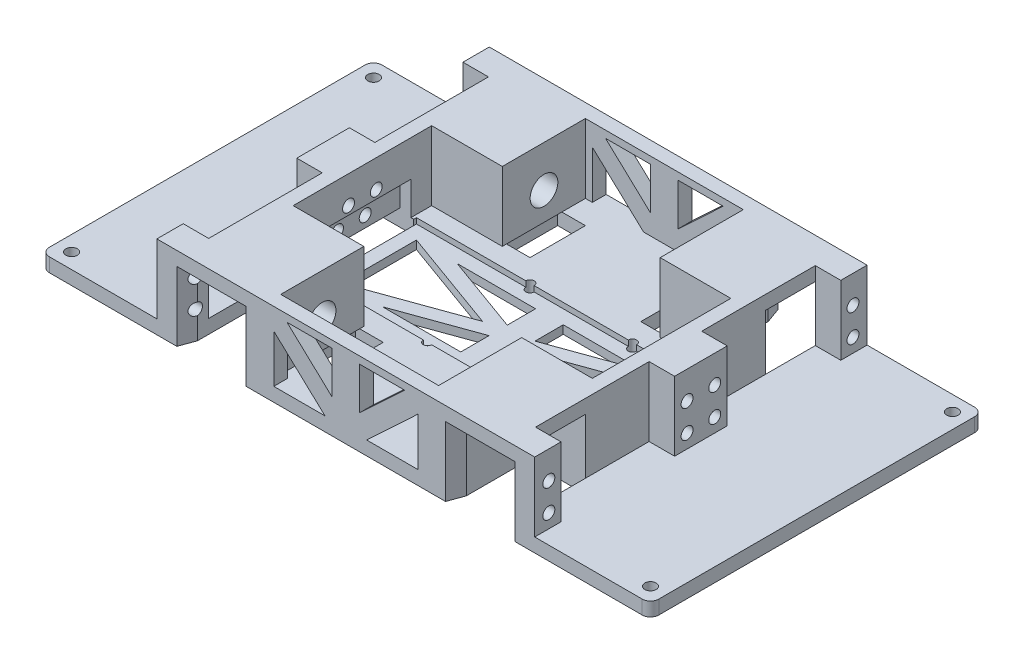
from build123d import *
from OCP.BRepFilletAPI import BRepFilletAPI_MakeChamfer

# Parameters (mm, degrees)
EXTRUDE_1_DEPTH          = 5
SKETCH_9_W               = 106
SKETCH_9_H               = 37
CUT_EXTRUDE_5_DEPTH      = 2
SKETCH_2_W               = 9.2
SKETCH_2_H               = 9.5
EXTRUDE_2_DEPTH          = 25
CUT_EXTRUDE_1_DEPTH      = 129.840987267
CUT_EXTRUDE_1_DEPTH_BACK = 129.840987267
SKETCH_4_R               = 2.15
SKETCH_6_R               = 5
CUT_EXTRUDE_2_DEPTH      = 45
CUT_EXTRUDE_3_REACH      = 192.408
SKETCH_7_R               = 2.15
CUT_EXTRUDE_4_REACH      = 192.408
SKETCH_8_R               = 2.15
CUT_EXTRUDE_6_DEPTH      = 12
CUT_EXTRUDE_6_DEPTH_BACK = 128.769323392
SKETCH_10_W              = 5
SKETCH_10_H              = 35
SKETCH_11_R              = 2.05
SKETCH_11_R_2            = 1.5
SKETCH_11_W              = 10
SKETCH_11_H              = 20
CUT_EXTRUDE_7_DEPTH      = 128.769323392
SKETCH_12_W              = 30.5
SKETCH_12_H              = 35
EXTRUDE_3_DEPTH          = 5
CUT_EXTRUDE_8_DEPTH      = 129.840987267
CUT_EXTRUDE_8_DEPTH_BACK = 129.840987267
CHAMFER_1_SIZE           = 1.5
CHAMFER_1_SIZE2          = 1.787630389
FILLET_1_R               = 3
CHAMFER_2_SIZE           = 6
CHAMFER_3_SIZE           = 5.494954839
CHAMFER_3_SIZE_2         = 2


with BuildPart() as part:
    # 草圖1 → 填料-伸長1 (new body)
    with BuildSketch(Plane(origin=(0, 0, 0), x_dir=(1, 0, 0), z_dir=(0, 1, 0))):
        Polygon((-110, -60), (-59, -60), (-59, -32.5), (-38, -32.5), (-38, -60), (38, -60), (38, -32.5), (59, -32.5), (59, -60), (110, -60), (110, 60), (59, 60), (59, 32.5), (38, 32.5), (38, 60), (-38, 60), (-38, 32.5), (-59, 32.5), (-59, 60), (-110, 60), align=None)
    extrude(amount=EXTRUDE_1_DEPTH)

    # 草圖9 → 除料-伸長5 (cut)
    with BuildSketch(Plane(origin=(0, 5, 0), x_dir=(1, 0, 0), z_dir=(0, 1, 0))):
        Rectangle(SKETCH_9_W, SKETCH_9_H)
    extrude(amount=-CUT_EXTRUDE_5_DEPTH, mode=Mode.SUBTRACT)

    # 草圖2 → 填料-伸長2 (add)
    # profile 1 of 5: a face of its own
    with BuildSketch(Plane(origin=(0, 5, 0), x_dir=(1, 0, 0), z_dir=(0, 1, 0))):
        Polygon((-59, 32.5), (-59, 9.5), (-68.2, 9.5), (-68.2, -9.5), (-59, -9.5), (-59, -32.5), (-38, -32.5), (-38, -60), (38, -60), (38, -32.5), (59, -32.5), (59, -9.5), (68.2, -9.5), (68.2, 9.5), (59, 9.5), (59, 32.5), (38, 32.5), (38, 60), (-38, 60), (-38, 32.5), align=None)
        Polygon((-28.5, 55), (28.5, 55), (28.5, 25), (54, 25), (54, -25), (28.5, -25), (28.5, -55), (-28.5, -55), (-28.5, -25), (-54, -25), (-54, 25), (-28.5, 25), align=None, mode=Mode.SUBTRACT)
    # profile 2 of 5: a face of its own
    with BuildSketch(Plane(origin=(0, 5, 0), x_dir=(1, 0, 0), z_dir=(0, 1, 0))):
        with Locations((-63.6, 55.25)):
            Rectangle(SKETCH_2_W, SKETCH_2_H)
    # profile 3 of 5: a face of its own
    with BuildSketch(Plane(origin=(0, 5, 0), x_dir=(1, 0, 0), z_dir=(0, 1, 0))):
        with Locations((63.6, 55.25)):
            Rectangle(SKETCH_2_W, SKETCH_2_H)
    # profile 4 of 5: a face of its own
    with BuildSketch(Plane(origin=(0, 5, 0), x_dir=(1, 0, 0), z_dir=(0, 1, 0))):
        with Locations((63.6, -55.25)):
            Rectangle(SKETCH_2_W, SKETCH_2_H)
    # profile 5 of 5: a face of its own
    with BuildSketch(Plane(origin=(0, 5, 0), x_dir=(1, 0, 0), z_dir=(0, 1, 0))):
        with Locations((-63.6, -55.25)):
            Rectangle(SKETCH_2_W, SKETCH_2_H)
    extrude(amount=EXTRUDE_2_DEPTH)

    # 草圖4 → 除料-伸長1 (cut, two sides: drawn at the far end of the back side and taken through both)
    with BuildSketch(Plane(origin=(0, 0, 0), x_dir=(0, 0, -1), z_dir=(1, 0, 0)).offset(-CUT_EXTRUDE_1_DEPTH_BACK)):
        with Locations(Location((-5, 20, 0), (0, 0, 180))):
            Circle(SKETCH_4_R)
        with Locations(Location((-5, 10, 0), (0, 0, 180))):
            Circle(SKETCH_4_R)
        with Locations(Location((5, 10, 0), (0, 0, 180))):
            Circle(SKETCH_4_R)
        with Locations(Location((5, 20, 0), (0, 0, 180))):
            Circle(SKETCH_4_R)
    extrude(amount=CUT_EXTRUDE_1_DEPTH + CUT_EXTRUDE_1_DEPTH_BACK, mode=Mode.SUBTRACT)

    # 草圖6 → 除料-伸長2 (cut, symmetric)
    with BuildSketch(Plane(origin=(0, 0, 0), x_dir=(0, 0, -1), z_dir=(1, 0, 0))):
        with Locations((-40.049999551, 15.006658077)):
            Circle(SKETCH_6_R)
        with Locations((40.049999551, 15.006658077)):
            Circle(SKETCH_6_R)
    extrude(amount=CUT_EXTRUDE_2_DEPTH, both=True, mode=Mode.SUBTRACT)

    # 草圖7 → 除料-伸長3 (cut, up to next)
    with BuildSketch(Plane.ZY.offset(68.2), mode=Mode.PRIVATE) as cut_extrude_3_sk1:
        with Locations((-54.9, 20)):
            Circle(SKETCH_7_R)
    cut_extrude_3_tool1 = extrude(cut_extrude_3_sk1.sketch, amount=-CUT_EXTRUDE_3_REACH, mode=Mode.PRIVATE) & part.part
    # 草圖7 → 除料-伸長3 (cut, up to next)
    with BuildSketch(Plane.ZY.offset(68.2), mode=Mode.PRIVATE) as cut_extrude_3_sk2:
        with Locations((-54.9, 10.006658077)):
            Circle(SKETCH_7_R)
    cut_extrude_3_tool2 = extrude(cut_extrude_3_sk2.sketch, amount=-CUT_EXTRUDE_3_REACH, mode=Mode.PRIVATE) & part.part
    # 草圖7 → 除料-伸長3 (cut, up to next)
    with BuildSketch(Plane.ZY.offset(68.2), mode=Mode.PRIVATE) as cut_extrude_3_sk3:
        with Locations((54.9, 10.006658077)):
            Circle(SKETCH_7_R)
    cut_extrude_3_tool3 = extrude(cut_extrude_3_sk3.sketch, amount=-CUT_EXTRUDE_3_REACH, mode=Mode.PRIVATE) & part.part
    # 草圖7 → 除料-伸長3 (cut, up to next)
    with BuildSketch(Plane.ZY.offset(68.2), mode=Mode.PRIVATE) as cut_extrude_3_sk4:
        with Locations((54.9, 20)):
            Circle(SKETCH_7_R)
    cut_extrude_3_tool4 = extrude(cut_extrude_3_sk4.sketch, amount=-CUT_EXTRUDE_3_REACH, mode=Mode.PRIVATE) & part.part
    add(cut_extrude_3_tool1.solids().sort_by_distance((-68.2, 20, -54.9))[0], mode=Mode.SUBTRACT)
    add(cut_extrude_3_tool2.solids().sort_by_distance((-68.2, 10.006658, -54.9))[0], mode=Mode.SUBTRACT)
    add(cut_extrude_3_tool3.solids().sort_by_distance((-68.2, 10.006658, 54.9))[0], mode=Mode.SUBTRACT)
    add(cut_extrude_3_tool4.solids().sort_by_distance((-68.2, 20, 54.9))[0], mode=Mode.SUBTRACT)

    # 草圖8 → 除料-伸長4 (cut, up to next)
    with BuildSketch(Plane(origin=(68.2, 0, 0), x_dir=(0, 0, -1), z_dir=(1, 0, 0)), mode=Mode.PRIVATE) as cut_extrude_4_sk1:
        with Locations(Location((-54.9, 10.006658077, 0), (0, 0, 180))):
            Circle(SKETCH_8_R)
    cut_extrude_4_tool1 = extrude(cut_extrude_4_sk1.sketch, amount=-CUT_EXTRUDE_4_REACH, mode=Mode.PRIVATE) & part.part
    # 草圖8 → 除料-伸長4 (cut, up to next)
    with BuildSketch(Plane(origin=(68.2, 0, 0), x_dir=(0, 0, -1), z_dir=(1, 0, 0)), mode=Mode.PRIVATE) as cut_extrude_4_sk2:
        with Locations(Location((-54.9, 20, 0), (0, 0, 180))):
            Circle(SKETCH_8_R)
    cut_extrude_4_tool2 = extrude(cut_extrude_4_sk2.sketch, amount=-CUT_EXTRUDE_4_REACH, mode=Mode.PRIVATE) & part.part
    # 草圖8 → 除料-伸長4 (cut, up to next)
    with BuildSketch(Plane(origin=(68.2, 0, 0), x_dir=(0, 0, -1), z_dir=(1, 0, 0)), mode=Mode.PRIVATE) as cut_extrude_4_sk3:
        with Locations(Location((54.9, 10.006658077, 0), (0, 0, 180))):
            Circle(SKETCH_8_R)
    cut_extrude_4_tool3 = extrude(cut_extrude_4_sk3.sketch, amount=-CUT_EXTRUDE_4_REACH, mode=Mode.PRIVATE) & part.part
    # 草圖8 → 除料-伸長4 (cut, up to next)
    with BuildSketch(Plane(origin=(68.2, 0, 0), x_dir=(0, 0, -1), z_dir=(1, 0, 0)), mode=Mode.PRIVATE) as cut_extrude_4_sk4:
        with Locations(Location((54.9, 20, 0), (0, 0, 180))):
            Circle(SKETCH_8_R)
    cut_extrude_4_tool4 = extrude(cut_extrude_4_sk4.sketch, amount=-CUT_EXTRUDE_4_REACH, mode=Mode.PRIVATE) & part.part
    add(cut_extrude_4_tool1.solids().sort_by_distance((68.2, 10.006658, 54.9))[0], mode=Mode.SUBTRACT)
    add(cut_extrude_4_tool2.solids().sort_by_distance((68.2, 20, 54.9))[0], mode=Mode.SUBTRACT)
    add(cut_extrude_4_tool3.solids().sort_by_distance((68.2, 10.006658, -54.9))[0], mode=Mode.SUBTRACT)
    add(cut_extrude_4_tool4.solids().sort_by_distance((68.2, 20, -54.9))[0], mode=Mode.SUBTRACT)

    # 草圖10 → 除料-伸長6 (cut, two sides: drawn at the far end of the back side and taken through both)
    with BuildSketch(Plane(origin=(0, 5, 0), x_dir=(1, 0, 0), z_dir=(0, 1, 0)).offset(-CUT_EXTRUDE_6_DEPTH_BACK)):
        with Locations((-55.5, 0)):
            Rectangle(SKETCH_10_W, SKETCH_10_H)
        with Locations((55.5, 0)):
            Rectangle(SKETCH_10_W, SKETCH_10_H)
    extrude(amount=CUT_EXTRUDE_6_DEPTH + CUT_EXTRUDE_6_DEPTH_BACK, mode=Mode.SUBTRACT)

    # 草圖11 → 除料-伸長7 (cut, through all)
    with BuildSketch(Plane(origin=(0, 5, 0), x_dir=(1, 0, 0), z_dir=(0, 1, 0))):
        with Locations(Location((104.5, 54.5, 0), (0, 0, 270))):
            Circle(SKETCH_11_R)
        with Locations(Location((-104.5, 54.5, 0), (0, 0, 90))):
            Circle(SKETCH_11_R)
        with Locations(Location((-104.5, -54.5, 0), (0, 0, 270))):
            Circle(SKETCH_11_R)
        with Locations(Location((104.5, -54.5, 0), (0, 0, 90))):
            Circle(SKETCH_11_R)
        with Locations(Location((-12, 18.5, 0), (0, 0, 270))):
            Circle(SKETCH_11_R_2)
        with Locations(Location((25, 18.5, 0), (0, 0, 270))):
            Circle(SKETCH_11_R_2)
        with Locations((25, -18.5)):
            Circle(SKETCH_11_R_2)
        with Locations((-12, -18.5)):
            Circle(SKETCH_11_R_2)
        Polygon((-48, 13.5), (-48, -13.5), (-10.631434842, 0), align=None)
        Polygon((-33.284314696, 13.5), (-5, 13.5), (-5, 3.281832758), align=None)
        Polygon((48, -13.5), (10.631434842, 0), (48, 13.5), align=None)
        Polygon((5, 13.5), (5, 3.281832758), (33.284314696, 13.5), align=None)
        Polygon((33.284314696, -13.5), (5, -13.5), (5, -3.281832758), align=None)
        Polygon((-5, -13.5), (-5, -3.281832758), (-33.284314696, -13.5), align=None)
        with Locations((25, 36.5)):
            Rectangle(SKETCH_11_W, SKETCH_11_H)
        with Locations((-25, 36.5)):
            Rectangle(SKETCH_11_W, SKETCH_11_H)
        with Locations((25, -36.5)):
            Rectangle(SKETCH_11_W, SKETCH_11_H)
        with Locations((-25, -36.5)):
            Rectangle(SKETCH_11_W, SKETCH_11_H)
    extrude(amount=-CUT_EXTRUDE_7_DEPTH, mode=Mode.SUBTRACT)

    # 草圖12 → 填料-伸長3 (add)
    with BuildSketch(Plane(origin=(0, 30, 0), x_dir=(1, 0, 0), z_dir=(0, 1, 0))):
        with Locations((-43.75, 42.5)):
            Rectangle(SKETCH_12_W, SKETCH_12_H)
        with Locations((43.75, 42.5)):
            Rectangle(SKETCH_12_W, SKETCH_12_H)
        with Locations((43.75, -42.5)):
            Rectangle(SKETCH_12_W, SKETCH_12_H)
        with Locations((-43.75, -42.5)):
            Rectangle(SKETCH_12_W, SKETCH_12_H)
    extrude(amount=-EXTRUDE_3_DEPTH)

    # 草圖13 → 除料-伸長8 (cut, two sides: drawn at the far end of the back side and taken through both)
    with BuildSketch(Plane.XY.offset(-CUT_EXTRUDE_8_DEPTH_BACK)):
        Polygon((-26, 22.289142729), (-26, 5), (-7.5, 5), align=None)
        Polygon((-21.244781105, 27.426165415), (-5, 12.24463357), (-5, 27.426165415), align=None)
        Polygon((26, 5), (7.5, 5), (26, 22.289142729), align=None)
        Polygon((5, 12.24463357), (5, 27.426165415), (21.244781105, 27.426165415), align=None)
    extrude(amount=CUT_EXTRUDE_8_DEPTH + CUT_EXTRUDE_8_DEPTH_BACK, mode=Mode.SUBTRACT)

    # 導角1: one chamfer whose edges measure the first distance from different faces: ONE call of the kernel's chamfer builder (chamfer() names one face for all edges)
    chamfer_1_edges_1 = [part.edges().sort_by_distance(p)[0] for p in [
        (-38, 15.006658077, 45.049999551),
    ]]
    chamfer_1_side_1 = [part.faces().sort_by_distance(p)[0] for p in [
        (-33.25, 15.006658077, 45.049999551),
    ]]
    chamfer_1_edges_2 = [part.edges().sort_by_distance(p)[0] for p in [
        (38, 15.006658077, 45.049999551),
    ]]
    chamfer_1_side_2 = [part.faces().sort_by_distance(p)[0] for p in [
        (33.25, 15.006658077, 45.049999551),
    ]]
    chamfer_1_edges_3 = [part.edges().sort_by_distance(p)[0] for p in [
        (38, 15.006658077, -35.049999551),
    ]]
    chamfer_1_side_3 = [part.faces().sort_by_distance(p)[0] for p in [
        (33.25, 15.006658077, -35.049999551),
    ]]
    chamfer_1_edges_4 = [part.edges().sort_by_distance(p)[0] for p in [
        (-38, 15.006658077, -35.049999551),
    ]]
    chamfer_1_side_4 = [part.faces().sort_by_distance(p)[0] for p in [
        (-33.25, 15.006658077, -35.049999551),
    ]]
    chamfer_1 = BRepFilletAPI_MakeChamfer(part.part.solid().wrapped)
    for e in chamfer_1_edges_1:
        chamfer_1.Add(CHAMFER_1_SIZE, CHAMFER_1_SIZE2, e.wrapped, chamfer_1_side_1[0].wrapped)  # the first distance lies on this face
    for e in chamfer_1_edges_2:
        chamfer_1.Add(CHAMFER_1_SIZE, CHAMFER_1_SIZE2, e.wrapped, chamfer_1_side_2[0].wrapped)  # the first distance lies on this face
    for e in chamfer_1_edges_3:
        chamfer_1.Add(CHAMFER_1_SIZE, CHAMFER_1_SIZE2, e.wrapped, chamfer_1_side_3[0].wrapped)  # the first distance lies on this face
    for e in chamfer_1_edges_4:
        chamfer_1.Add(CHAMFER_1_SIZE, CHAMFER_1_SIZE2, e.wrapped, chamfer_1_side_4[0].wrapped)  # the first distance lies on this face
    add(Compound.cast(chamfer_1.Shape()), mode=Mode.REPLACE)

    # 圓角1
    fillet_1_edges = [part.edges().sort_by_distance(p)[0] for p in [
        (110, 2.5, -60),
        (110, 2.5, 60),
        (-110, 2.5, 60),
        (-110, 2.5, -60),
    ]]
    fillet(fillet_1_edges, radius=FILLET_1_R)

    # 導角2
    chamfer_2_edges = [part.edges().sort_by_distance(p)[0] for p in [
        (-58, 0, 0),
        (58, 0, 0),
    ]]
    chamfer(chamfer_2_edges, length=CHAMFER_2_SIZE)

    # 導角3
    # the kernel refuses this chamfer: 5.494954839, 2 mm, written as the material it takes off along each edge
    with BuildSketch(Plane(origin=(-59, 25, -60), x_dir=(0.013184058198646324, 0, 0.9999130865277316), z_dir=(0, -1, 0)), Plane(origin=(-38, -14.254982899, -60), x_dir=(-0.013184058198646324, 0, 0.9999130865277316), z_dir=(0, 1, 0)), Plane(origin=(59, -14.254982899, -60), x_dir=(-0.013184058198646324, 0, 0.9999130865277316), z_dir=(0, 1, 0)), Plane(origin=(38, -14.254982899, 60), x_dir=(0.013184058198646324, 0, -0.9999130865277316), z_dir=(0, 1, 0)), Plane(origin=(-59, -14.254982899, 60), x_dir=(0.013184058198646324, 0, -0.9999130865277316), z_dir=(0, 1, 0))) as chamfer_3_piece_1:
        Polygon((CHAMFER_3_SIZE * 0.999913086511, CHAMFER_3_SIZE * 0.0131840581984), (-CHAMFER_3_SIZE_2 * 0.0131840581986, CHAMFER_3_SIZE_2 * 0.999913086528), (0, 0), align=None)
    extrude(amount=39.254982899, mode=Mode.SUBTRACT)
    with BuildSketch(Plane(origin=(38, -14.254982899, -60), x_dir=(0.013184058198646324, 0, 0.9999130865277316), z_dir=(0, 1, 0)), Plane(origin=(59, -14.254982899, 60), x_dir=(-0.013184058198646324, 0, -0.9999130865277316), z_dir=(0, 1, 0)), Plane(origin=(-38, -14.254982899, 60), x_dir=(-0.013184058198646324, 0, -0.9999130865277316), z_dir=(0, 1, 0))) as chamfer_3_piece_2:
        Polygon((CHAMFER_3_SIZE * 0.999913086511, -CHAMFER_3_SIZE * 0.0131840581984), (-CHAMFER_3_SIZE_2 * 0.0131840581986, -CHAMFER_3_SIZE_2 * 0.999913086528), (0, 0), align=None)
    extrude(amount=39.254982899, mode=Mode.SUBTRACT)


solid = part.part
